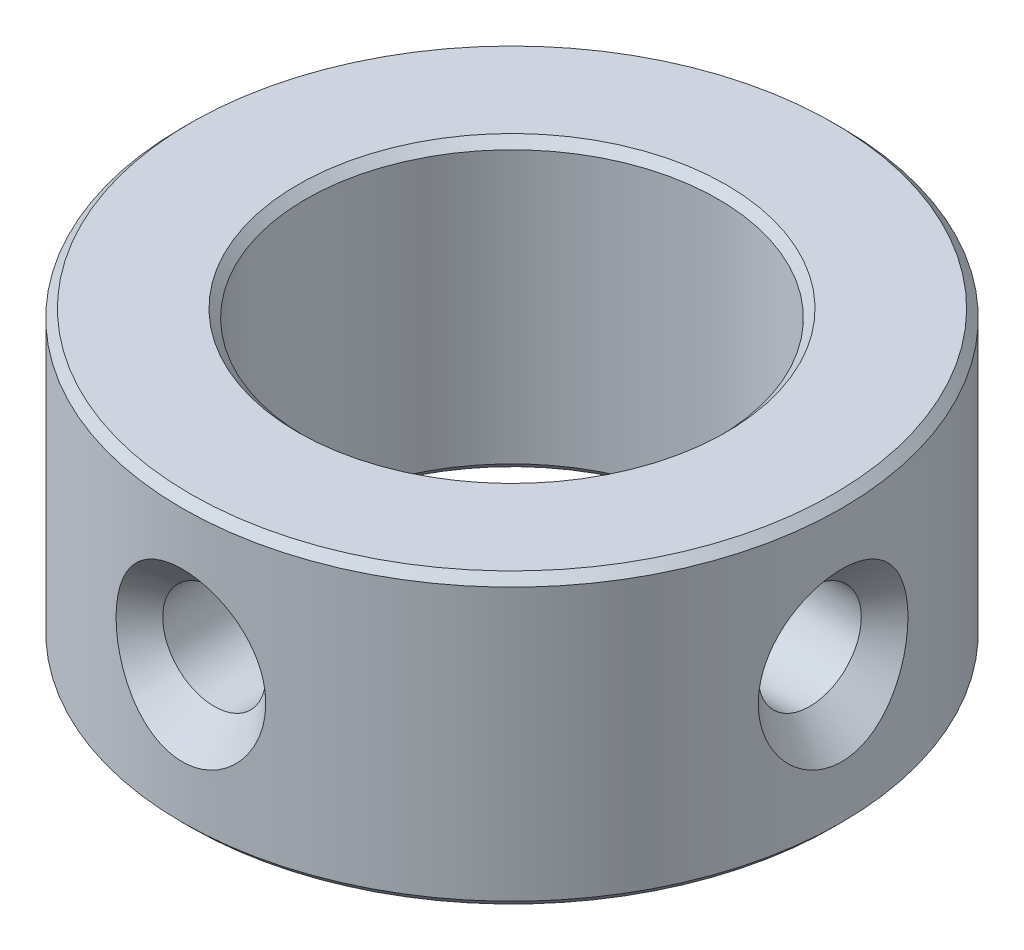
from build123d import *

# Parameters (mm, degrees)
PROFILE_SKETCH_R                 = 8
PROFILE_SKETCH_R_2               = 5
PROFILE_DEPTH                    = 3.5
SET_SCREW_CIRCULAR_PATTERN_COUNT = 2
SET_SCREW_CIRCULAR_PATTERN_ANGLE = 90
OUTER_CHAMFER_SIZE               = 0.2
INNER_CHAMFER_SIZE               = 0.2


# Read off the part's stored shape, not the designer's step:  Tapped Hole1
with BuildPart() as part:
    # Profile Sketch → Profile (new, symmetric)
    with BuildSketch(Plane(origin=(0, 0, 0), x_dir=(1, 0, 0), z_dir=(0, 1, 0))):
        with Locations(Location((0, 0, 0), (0, 0, 270))):
            Circle(PROFILE_SKETCH_R)
        with Locations(Location((0, 0, 0), (0, 0, 270))):
            Circle(PROFILE_SKETCH_R_2, mode=Mode.SUBTRACT)
    extrude(amount=PROFILE_DEPTH, both=True)

    # Tapped Hole1 outline → Tapped Hole1 (revolve, cut)
    with BuildSketch(Plane.XZ):
        Polygon((2.025000231, 8.000000231), (0, 8.000000231), (0, 4.841160984), (1.25, 4.841160984), (1.25, 7.225), align=None)
    tapped_hole1 = revolve(axis=Axis((0, 0, 0), (0, 0, 1)), mode=Mode.SUBTRACT)

    # Set Screw Circular Pattern: Tapped Hole1 ×2 about axis
    set_screw_circular_pattern_axis = Axis((0, 3.5, 0), (0, 1, 0))
    for i in range(1, SET_SCREW_CIRCULAR_PATTERN_COUNT):
        add(tapped_hole1.rotate(set_screw_circular_pattern_axis, i * SET_SCREW_CIRCULAR_PATTERN_ANGLE / (SET_SCREW_CIRCULAR_PATTERN_COUNT - 1)), mode=Mode.SUBTRACT)

    # Outer Chamfer
    outer_chamfer_edges = [part.edges().sort_by_distance(p)[0] for p in [
        (0, -3.5, -8),
        (0, 3.5, -8),
    ]]
    chamfer(outer_chamfer_edges, length=OUTER_CHAMFER_SIZE)

    # Inner Chamfer
    inner_chamfer_edges = [part.edges().sort_by_distance(p)[0] for p in [
        (0, -3.5, -5),
        (0, 3.5, -5),
    ]]
    chamfer(inner_chamfer_edges, length=INNER_CHAMFER_SIZE)


solid = part.part
